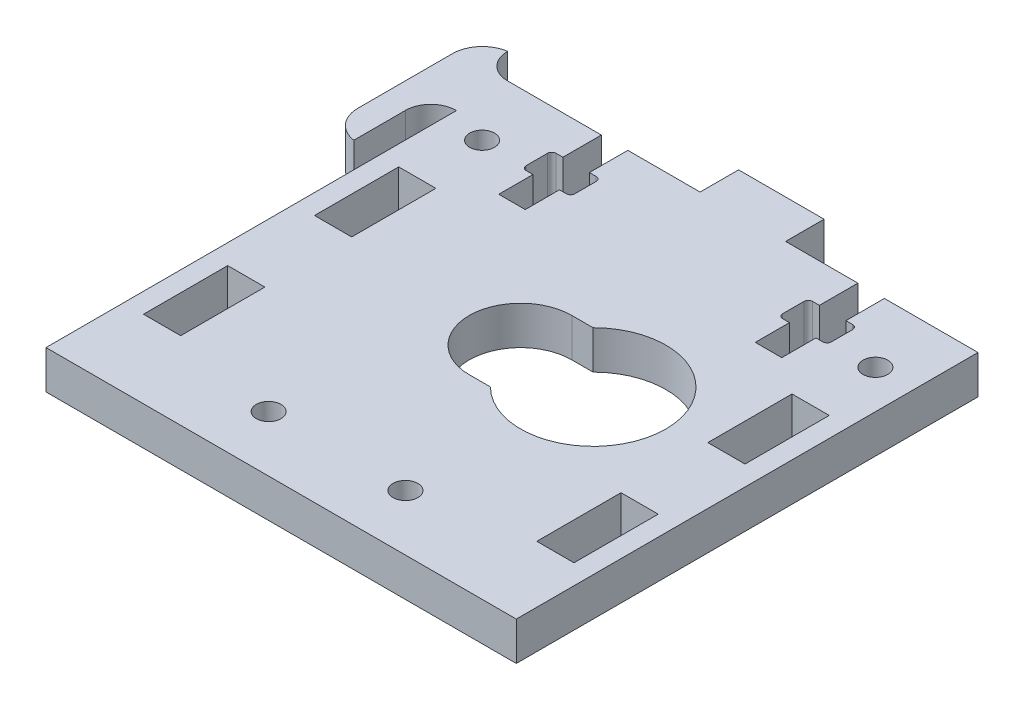
from build123d import *

# Parameters (mm, degrees)
SKETCH1_W           = 55
SKETCH1_H           = 54
MAINSHAPE_DEPTH     = 4.5
SKETCH2_W           = 10
SKETCH2_H           = 9
TAB1_DEPTH          = 4.5
CUT_EXTRUDE2_DEPTH  = 43.056509603
SKETCH5_W           = 4.35
SKETCH5_H           = 9.85
CUT_EXTRUDE3_DEPTH  = 43.056509603
SKETCH6_R           = 12
CUT_EXTRUDE4_DEPTH  = 43.056509603
SKETCH8_R           = 1.45
CUT_EXTRUDE6_DEPTH  = 43.056509603
SKETCH11_R          = 1.45
CUT_EXTRUDE8_DEPTH  = 43.056509603
SKETCH15_R          = 12
SKETCH15_R_2        = 6
BOSS_EXTRUDE2_DEPTH = 4.5
CUT_EXTRUDE10_DEPTH = 43.056509603
BOSS_EXTRUDE3_DEPTH = 4.5
FILLET1_R           = 3.5


with BuildPart() as part:
    # Sketch1 → MainShape (new body)
    with BuildSketch(Plane(origin=(0, 0, 0), x_dir=(1, 0, 0), z_dir=(0, 1, 0))):
        Rectangle(SKETCH1_W, SKETCH1_H)
    extrude(amount=MAINSHAPE_DEPTH)

    # Sketch2 → Tab1 (add, through all)
    with BuildSketch(Plane(origin=(0, 4.5, 0), x_dir=(1, 0, 0), z_dir=(0, 1, 0))):
        with Locations((0, 27)):
            Rectangle(SKETCH2_W, SKETCH2_H)
    extrude(amount=-TAB1_DEPTH)

    # Sketch4 → Cut-Extrude2 (cut, through all)
    with BuildSketch(Plane(origin=(0, 4.5, 0), x_dir=(1, 0, 0), z_dir=(0, 1, 0))):
        with BuildLine():
            Line((-13.45, 15), (-16.55, 15))
            Line((-16.55, 15), (-16.55, 19))
            Line((-16.55, 19), (-17.35, 19))
            ThreePointArc((-17.35, 19), (-17.703553391, 19.146446609), (-17.85, 19.5))
            Line((-17.85, 19.5), (-17.85, 22))
            ThreePointArc((-17.85, 22), (-17.703553391, 22.353553391), (-17.35, 22.5))
            Line((-17.35, 22.5), (-16.55, 22.5))
            Line((-16.55, 22.5), (-16.55, 27))
            Line((-16.55, 27), (-13.45, 27))
            Line((-13.45, 27), (-13.45, 22.5))
            Line((-13.45, 22.5), (-12.65, 22.5))
            ThreePointArc((-12.65, 22.5), (-12.296446609, 22.353553391), (-12.15, 22))
            Line((-12.15, 22), (-12.15, 19.5))
            ThreePointArc((-12.15, 19.5), (-12.296446609, 19.146446609), (-12.65, 19))
            Line((-12.65, 19), (-13.45, 19))
            Line((-13.45, 19), (-13.45, 15))
        make_face()
        with BuildLine():
            Line((13.45, 15), (13.45, 19))
            Line((13.45, 19), (12.65, 19))
            ThreePointArc((12.65, 19), (12.296446609, 19.146446609), (12.15, 19.5))
            Line((12.15, 19.5), (12.15, 22))
            ThreePointArc((12.15, 22), (12.296446609, 22.353553391), (12.65, 22.5))
            Line((12.65, 22.5), (13.45, 22.5))
            Line((13.45, 22.5), (13.45, 27))
            Line((13.45, 27), (16.55, 27))
            Line((16.55, 27), (16.55, 22.5))
            Line((16.55, 22.5), (17.35, 22.5))
            ThreePointArc((17.35, 22.5), (17.703553391, 22.353553391), (17.85, 22))
            Line((17.85, 22), (17.85, 19.5))
            ThreePointArc((17.85, 19.5), (17.703553391, 19.146446609), (17.35, 19))
            Line((17.35, 19), (16.55, 19))
            Line((16.55, 19), (16.55, 15))
            Line((16.55, 15), (13.45, 15))
        make_face()
    extrude(amount=-CUT_EXTRUDE2_DEPTH, mode=Mode.SUBTRACT)

    # Sketch5 → Cut-Extrude3 (cut, through all)
    with BuildSketch(Plane(origin=(0, 4.5, 0), x_dir=(1, 0, 0), z_dir=(0, 1, 0))):
        with Locations((23, 7)):
            Rectangle(SKETCH5_W, SKETCH5_H)
        with Locations((-23, 7)):
            Rectangle(SKETCH5_W, SKETCH5_H)
        with Locations((-23, -13)):
            Rectangle(SKETCH5_W, SKETCH5_H)
        with Locations((23, -13)):
            Rectangle(SKETCH5_W, SKETCH5_H)
    extrude(amount=-CUT_EXTRUDE3_DEPTH, mode=Mode.SUBTRACT)

    # Sketch6 → Cut-Extrude4 (cut, through all)
    with BuildSketch(Plane(origin=(0, 4.5, 0), x_dir=(1, 0, 0), z_dir=(0, 1, 0))):
        with Locations(Location((0, 1, 0), (0, 0, 270))):
            Circle(SKETCH6_R)
    extrude(amount=-CUT_EXTRUDE4_DEPTH, mode=Mode.SUBTRACT)

    # Sketch8 → Cut-Extrude6 (cut, through all)
    with BuildSketch(Plane(origin=(0, 4.5, 0), x_dir=(1, 0, 0), z_dir=(0, 1, 0))):
        with Locations(Location((-8, -20.46, 0), (0, 0, 270))):
            Circle(SKETCH8_R)
        with Locations(Location((8, -20.46, 0), (0, 0, 90))):
            Circle(SKETCH8_R)
    extrude(amount=-CUT_EXTRUDE6_DEPTH, mode=Mode.SUBTRACT)

    # Sketch11 → Cut-Extrude8 (cut, through all)
    with BuildSketch(Plane(origin=(0, 4.5, 0), x_dir=(1, 0, 0), z_dir=(0, 1, 0))):
        with Locations(Location((-23, 19.5, 0), (0, 0, 270))):
            Circle(SKETCH11_R)
        with Locations(Location((23, 19.5, 0), (0, 0, 90))):
            Circle(SKETCH11_R)
    extrude(amount=-CUT_EXTRUDE8_DEPTH, mode=Mode.SUBTRACT)

    # Sketch15 → Boss-Extrude2 (add, through all)
    with BuildSketch(Plane(origin=(0, 4.5, 0), x_dir=(1, 0, 0), z_dir=(0, 1, 0))):
        with Locations((0, 1)):
            Circle(SKETCH15_R)
        with Locations(Location((0, 1, 0), (0, 0, 270))):
            Circle(SKETCH15_R_2, mode=Mode.SUBTRACT)
    extrude(amount=-BOSS_EXTRUDE2_DEPTH)

    # Sketch16 → Cut-Extrude10 (cut, through all)
    with BuildSketch(Plane(origin=(0, 4.5, 0), x_dir=(1, 0, 0), z_dir=(0, 1, 0))):
        with BuildLine():
            Line((0, 7), (2.479202711, 7))
            ThreePointArc((2.479202711, 7), (17, 1), (2.479202711, -5))
            Line((2.479202711, -5), (0, -5))
            Line((0, -5), (0, 7))
        make_face()
    extrude(amount=-CUT_EXTRUDE10_DEPTH, mode=Mode.SUBTRACT)

    # Sketch18 → Boss-Extrude3 (add, through all)
    with BuildSketch(Plane(origin=(0, 4.5, 0), x_dir=(1, 0, 0), z_dir=(0, 1, 0))):
        with BuildLine():
            Line((-27.5, 27), (-27.55, 27))
            ThreePointArc((-27.55, 27), (-29.635965005, 27.864034995), (-30.5, 29.95))
            Line((-30.5, 29.95), (-30.5, 30))
            Line((-30.5, 30), (-33.5, 30))
            Line((-33.5, 30), (-33.5, 12))
            Line((-33.5, 12), (-30.5, 12))
            Line((-30.5, 12), (-30.5, 18.05))
            ThreePointArc((-30.5, 18.05), (-29.635965005, 20.135965005), (-27.55, 21))
            Line((-27.55, 21), (-27.5, 21))
            Line((-27.5, 21), (-27.5, 27))
        make_face()
    extrude(amount=-BOSS_EXTRUDE3_DEPTH)

    # Fillet1
    # the kernel refuses this fillet: 3.5 mm, written as the material it takes off along each edge
    with BuildSketch(Plane(origin=(-33.5, 13.160254038, -30), x_dir=(0, 0, 1), z_dir=(0, -1, 0))) as fillet1_piece_1:
        with BuildLine():
            CenterArc((3.464101615, -3.5), FILLET1_R, 90, 81.786789298)
            Line((0, -3), (-0.069282032, -2.99))
            ThreePointArc((-0.069282032, -2.99), (-0.07, -1.5), (-0.07, 0))
            Line((-0.07, 0), (0, 0.07))
            Line((0, 0.07), (3.464101615, 0.07))
            Line((3.464101615, 0.07), (3.464101615, 0))
        make_face()
    extrude(amount=21.820508076, mode=Mode.SUBTRACT)
    with BuildSketch(Plane(origin=(-33.5, 13.160254038, -12), x_dir=(1, 0, 0), z_dir=(0, -1, 0))) as fillet1_piece_2:
        with BuildLine():
            CenterArc((3.5, -3.464101615), FILLET1_R, 98.213210702, 81.786789298)
            Line((0, -3.464101615), (-0.07, -3.464101615))
            Line((-0.07, -3.464101615), (-0.07, 0))
            Line((-0.07, 0), (0, 0.07))
            ThreePointArc((0, 0.07), (1.5, 0.07), (2.99, 0.069282032))
            Line((2.99, 0.069282032), (3, 0))
        make_face()
    extrude(amount=21.820508076, mode=Mode.SUBTRACT)


solid = part.part
